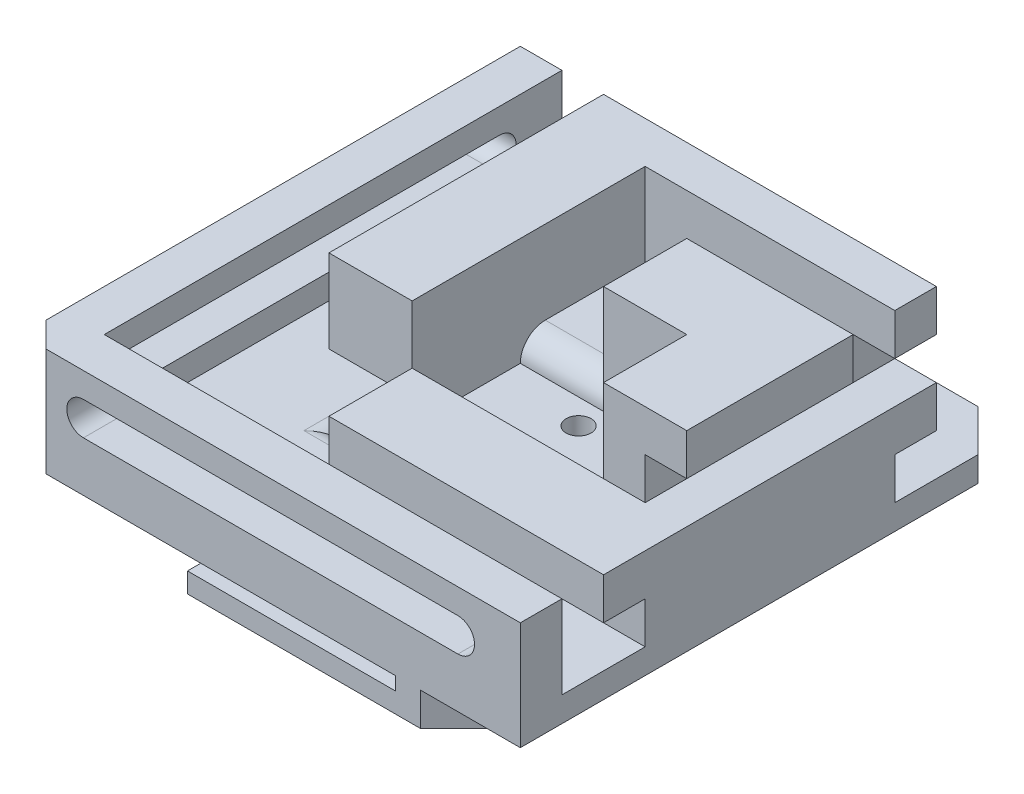
from build123d import *

# Parameters (mm, degrees)
SKETCH_2_W           = 60
SKETCH_2_H           = 60
EXTRUDE_1_DEPTH      = 3
SKETCH_6_R           = 1.5
CUT_EXTRUDE_2_DEPTH  = 3
EXTRUDE_START        = -30
EXTRUDE_2_DEPTH      = 30
EXTRUDE_START_2      = 30
EXTRUDE_3_DEPTH      = 30
CUT_EXTRUDE_START    = 13
SKETCH_9_W           = 10
SKETCH_9_H           = 10
CUT_EXTRUDE_3_DEPTH  = 10
CUT_EXTRUDE_START_2  = -15
SKETCH_10_W          = 5
SKETCH_10_H          = 5
CUT_EXTRUDE_4_DEPTH  = 5
CUT_EXTRUDE_START_3  = 10
SKETCH_11_W          = 5
SKETCH_11_H          = 5
CUT_EXTRUDE_5_DEPTH  = 5
EXTRUDE_5_DEPTH      = 1.6
EXTRUDE_START_3      = -1.6
SKETCH_17_W          = 28
SKETCH_17_H          = 8
SKETCH_17_W_2        = 8
SKETCH_17_H_2        = 28
EXTRUDE_6_DEPTH      = 2
SKETCH_21_R          = 12.5
EXTRUDE_8_DEPTH      = 4
CUT_EXTRUDE_START_4  = -4
SKETCH_22_R          = 1.5
CUT_EXTRUDE_6_DEPTH  = 4
EXTRUDE_START_4      = -4
SKETCH_23_R          = 1.5
EXTRUDE_9_DEPTH      = 4
EXTRUDE_START_5      = -3.6
SKETCH_24_W          = 8
SKETCH_24_H          = 28
SKETCH_24_W_2        = 28
SKETCH_24_H_2        = 8
EXTRUDE_10_DEPTH     = 0.4
EXTRUDE_START_6      = 3
SKETCH_25_W          = 10
SKETCH_25_H          = 3
SKETCH_25_W_2        = 3
SKETCH_25_H_2        = 10
EXTRUDE_11_DEPTH     = 10
SKETCH_26_W          = 55
SKETCH_26_H          = 5
SKETCH_26_W_2        = 5
SKETCH_26_H_2        = 55
EXTRUDE_12_DEPTH     = 10
CUT_EXTRUDE_START_5  = -30
CUT_EXTRUDE_7_DEPTH  = 5
CUT_EXTRUDE_START_6  = 25
CUT_EXTRUDE_8_DEPTH  = 5
CUT_EXTRUDE_START_7  = 3
SKETCH_31_R          = 1
CUT_EXTRUDE_10_DEPTH = 3
CUT_EXTRUDE_11_DEPTH = 4
CUT_EXTRUDE_12_DEPTH = 13
SKETCH_34_W          = 20
SKETCH_34_H          = 20
CUT_EXTRUDE_14_DEPTH = 3
SKETCH_35_W          = 20
SKETCH_35_H          = 10
EXTRUDE_14_DEPTH     = 5
SKETCH_36_W          = 20
SKETCH_36_H          = 10
EXTRUDE_15_DEPTH     = 5
EXTRUDE_16_DEPTH     = 5
EXTRUDE_18_DEPTH     = 5
EXTRUDE_19_DEPTH     = 4
CUT_EXTRUDE_START_8  = -22
CUT_EXTRUDE_15_DEPTH = 44
CUT_EXTRUDE_16_DEPTH = 44
FILLET_1_R           = 5
FILLET_2_R           = 3


# Some blends are built 0.0001 mm under size
with BuildPart() as part:
    # 草图2 → 凸台-拉伸1 (new body)
    with BuildSketch(Plane(origin=(0, 0, 0), x_dir=(1, 0, 0), z_dir=(0, 1, 0))):
        Rectangle(SKETCH_2_W, SKETCH_2_H)
    extrude(amount=EXTRUDE_1_DEPTH)

    # 草图6 → 切除-拉伸2 (cut)
    with BuildSketch(Plane(origin=(0, 0, 0), x_dir=(1, 0, 0), z_dir=(0, 1, 0))):
        with Locations(Location((0, -7, 0), (0, 0, 270))):
            Circle(SKETCH_6_R)
        with Locations(Location((7, 0, 0), (0, 0, 270))):
            Circle(SKETCH_6_R)
        with Locations(Location((0, 7, 0), (0, 0, 270))):
            Circle(SKETCH_6_R)
        with Locations(Location((-7, 0, 0), (0, 0, 270))):
            Circle(SKETCH_6_R)
    extrude(amount=CUT_EXTRUDE_2_DEPTH, mode=Mode.SUBTRACT)

    # 草图7 → 凸台-拉伸2 (add)
    with BuildSketch(Plane.XY.offset(EXTRUDE_START)):
        Polygon((-15, 3), (-15, 8), (-20, 8), (-20, 13), (-10, 13), (-10, 3), align=None)
        Polygon((10, 3), (15, 3), (15, 8), (20, 8), (20, 13), (10, 13), align=None)
    extrude(amount=EXTRUDE_2_DEPTH)

    # 草图8 → 凸台-拉伸3 (add)
    with BuildSketch(Plane(origin=(0, 0, 0), x_dir=(0, 0, -1), z_dir=(1, 0, 0)).offset(EXTRUDE_START_2)):
        Polygon((-15, 3), (-15, 8), (-20, 8), (-20, 13), (-10, 13), (-10, 3), align=None)
        Polygon((10, 3), (15, 3), (15, 8), (20, 8), (20, 13), (10, 13), align=None)
    extrude(amount=-EXTRUDE_3_DEPTH)

    # 草图9 → 切除-拉伸3 (cut)
    with BuildSketch(Plane(origin=(0, 0, 0), x_dir=(1, 0, 0), z_dir=(0, 1, 0)).offset(CUT_EXTRUDE_START)):
        with Locations((25, 15)):
            Rectangle(SKETCH_9_W, SKETCH_9_H)
        with Locations((15, 25)):
            Rectangle(SKETCH_9_W, SKETCH_9_H)
    extrude(amount=-CUT_EXTRUDE_3_DEPTH, mode=Mode.SUBTRACT)

    # 草图10 → 切除-拉伸4 (cut)
    with BuildSketch(Plane.XY.offset(CUT_EXTRUDE_START_2)):
        with Locations((17.5, 5.5)):
            Rectangle(SKETCH_10_W, SKETCH_10_H)
    extrude(amount=CUT_EXTRUDE_4_DEPTH, mode=Mode.SUBTRACT)

    # 草图11 → 切除-拉伸5 (cut)
    with BuildSketch(Plane(origin=(0, 0, 0), x_dir=(0, 0, -1), z_dir=(1, 0, 0)).offset(CUT_EXTRUDE_START_3)):
        with Locations((17.5, 5.5)):
            Rectangle(SKETCH_11_W, SKETCH_11_H)
    extrude(amount=CUT_EXTRUDE_5_DEPTH, mode=Mode.SUBTRACT)

    # 草图16 → 凸台-拉伸5 (add)
    with BuildSketch(Plane(origin=(0, 0, 0), x_dir=(1, 0, 0), z_dir=(0, 1, 0))):
        Polygon((-10, -25), (15, -25), (15, -30), (18, -30), (18, -22), (-10, -22), align=None)
        Polygon((-22, 18), (-22, -10), (-25, -10), (-25, 15), (-30, 15), (-30, 18), align=None)
    extrude(amount=-EXTRUDE_5_DEPTH)

    # 草图17 → 凸台-拉伸6 (add)
    with BuildSketch(Plane(origin=(0, 0, 0), x_dir=(1, 0, 0), z_dir=(0, 1, 0)).offset(EXTRUDE_START_3)):
        with Locations((4, -26)):
            Rectangle(SKETCH_17_W, SKETCH_17_H)
        with Locations((-26, 4)):
            Rectangle(SKETCH_17_W_2, SKETCH_17_H_2)
    extrude(amount=-EXTRUDE_6_DEPTH)

    # 草图21 → 凸台-拉伸8 (add)
    with BuildSketch(Plane(origin=(0, 0, 0), x_dir=(1, 0, 0), z_dir=(0, 1, 0))):
        with Locations(Location((0, 0, 0), (0, 0, 270))):
            Circle(SKETCH_21_R)
    extrude(amount=-EXTRUDE_8_DEPTH)

    # 草图22 → 切除-拉伸6 (cut)
    with BuildSketch(Plane(origin=(0, 0, 0), x_dir=(1, 0, 0), z_dir=(0, 1, 0)).offset(CUT_EXTRUDE_START_4)):
        with Locations(Location((7, 0, 0), (0, 0, 270))):
            Circle(SKETCH_22_R)
        with Locations(Location((0, -7, 0), (0, 0, 270))):
            Circle(SKETCH_22_R)
        with Locations(Location((-7, 0, 0), (0, 0, 270))):
            Circle(SKETCH_22_R)
        with Locations(Location((0, 7, 0), (0, 0, 270))):
            Circle(SKETCH_22_R)
    extrude(amount=CUT_EXTRUDE_6_DEPTH, mode=Mode.SUBTRACT)

    # 草图23 → 凸台-拉伸9 (add)
    with BuildSketch(Plane(origin=(0, 0, 0), x_dir=(1, 0, 0), z_dir=(0, 1, 0)).offset(EXTRUDE_START_4)):
        Polygon((22, -18), (18, -22), (-10, -22), (-22, -10), (-22, 18), (-18, 22), (-18, 30), (18, 30), (18, 22), (22, 18), (30, 18), (30, -18), align=None)
        with Locations(Location((0, 7, 0), (0, 0, 270))):
            Circle(SKETCH_23_R, mode=Mode.SUBTRACT)
        with Locations(Location((7, 0, 0), (0, 0, 270))):
            Circle(SKETCH_23_R, mode=Mode.SUBTRACT)
        with Locations(Location((-7, 0, 0), (0, 0, 270))):
            Circle(SKETCH_23_R, mode=Mode.SUBTRACT)
        with Locations(Location((0, -7, 0), (0, 0, 270))):
            Circle(SKETCH_23_R, mode=Mode.SUBTRACT)
    extrude(amount=EXTRUDE_9_DEPTH)

    # 草图24 → 凸台-拉伸10 (add)
    with BuildSketch(Plane(origin=(0, 0, 0), x_dir=(1, 0, 0), z_dir=(0, 1, 0)).offset(EXTRUDE_START_5)):
        with Locations((-26, 4)):
            Rectangle(SKETCH_24_W, SKETCH_24_H)
        with Locations((4, -26)):
            Rectangle(SKETCH_24_W_2, SKETCH_24_H_2)
    extrude(amount=-EXTRUDE_10_DEPTH)

    # 草图25 → 凸台-拉伸11 (add)
    with BuildSketch(Plane(origin=(0, 0, 0), x_dir=(1, 0, 0), z_dir=(0, 1, 0)).offset(EXTRUDE_START_6)):
        with Locations((-15, -1.5)):
            Rectangle(SKETCH_25_W, SKETCH_25_H)
        with Locations((-1.5, -15)):
            Rectangle(SKETCH_25_W_2, SKETCH_25_H_2)
    extrude(amount=EXTRUDE_11_DEPTH)

    # 草图26 → 凸台-拉伸12 (add)
    with BuildSketch(Plane(origin=(0, 0, 0), x_dir=(1, 0, 0), z_dir=(0, 1, 0)).offset(EXTRUDE_START_6)):
        with Locations((2.5, -27.5)):
            Rectangle(SKETCH_26_W, SKETCH_26_H)
        with Locations((-27.5, 2.5)):
            Rectangle(SKETCH_26_W_2, SKETCH_26_H_2)
        with Locations((-27.5, -27.5)):
            Rectangle(SKETCH_26_W_2, SKETCH_26_H)
    extrude(amount=EXTRUDE_12_DEPTH)

    # 草图27 → 切除-拉伸7 (cut)
    with BuildSketch(Plane(origin=(0, 0, 0), x_dir=(0, 0, -1), z_dir=(1, 0, 0)).offset(CUT_EXTRUDE_START_5)):
        with BuildLine():
            Line((22.5, 6), (-22.5, 6))
            ThreePointArc((-22.5, 6), (-24.5, 8), (-22.5, 10))
            Line((-22.5, 10), (22.5, 10))
            ThreePointArc((22.5, 10), (24.5, 8), (22.5, 6))
        make_face()
    extrude(amount=CUT_EXTRUDE_7_DEPTH, mode=Mode.SUBTRACT)

    # 草图28 → 切除-拉伸8 (cut)
    with BuildSketch(Plane.XY.offset(CUT_EXTRUDE_START_6)):
        with BuildLine():
            Line((-22.5, 10), (22.5, 10))
            ThreePointArc((22.5, 10), (24.5, 8), (22.5, 6))
            Line((22.5, 6), (-22.5, 6))
            ThreePointArc((-22.5, 6), (-24.5, 8), (-22.5, 10))
        make_face()
    extrude(amount=CUT_EXTRUDE_8_DEPTH, mode=Mode.SUBTRACT)

    # 草图31 → 切除-拉伸10 (cut)
    with BuildSketch(Plane(origin=(0, 0, 0), x_dir=(1, 0, 0), z_dir=(0, 1, 0)).offset(CUT_EXTRUDE_START_7)):
        with Locations(Location((-20, -20, 0), (0, 0, 270))):
            Circle(SKETCH_31_R)
    extrude(amount=-CUT_EXTRUDE_10_DEPTH, mode=Mode.SUBTRACT)

    # 草图32 → 切除-拉伸11 (cut)
    with BuildSketch(Plane(origin=(0, 0, 0), x_dir=(1, 0, 0), z_dir=(0, 1, 0))):
        Polygon((30, 30), (30, 25), (25, 30), align=None)
    extrude(amount=CUT_EXTRUDE_11_DEPTH, mode=Mode.SUBTRACT)

    # 草图33 → 切除-拉伸12 (cut)
    with BuildSketch(Plane(origin=(0, 0, 0), x_dir=(1, 0, 0), z_dir=(0, 1, 0))):
        Polygon((-30, -30), (-27, -30), (-30, -27), align=None)
    extrude(amount=CUT_EXTRUDE_12_DEPTH, mode=Mode.SUBTRACT)

    # 草图34 → 切除-拉伸14 (cut)
    with BuildSketch(Plane(origin=(0, 0, 0), x_dir=(1, 0, 0), z_dir=(0, 1, 0)).offset(CUT_EXTRUDE_START_7)):
        Rectangle(SKETCH_34_W, SKETCH_34_H)
    extrude(amount=-CUT_EXTRUDE_14_DEPTH, mode=Mode.SUBTRACT)

    # 草图35 → 凸台-拉伸14 (add)
    with BuildSketch(Plane(origin=(0, 0, 0), x_dir=(0, 0, -1), z_dir=(1, 0, 0)).offset(EXTRUDE_START_2)):
        with Locations((0, 8)):
            Rectangle(SKETCH_35_W, SKETCH_35_H)
    extrude(amount=-EXTRUDE_14_DEPTH)

    # 草图36 → 凸台-拉伸15 (add)
    with BuildSketch(Plane.XY.offset(EXTRUDE_START)):
        with Locations((0, 8)):
            Rectangle(SKETCH_36_W, SKETCH_36_H)
    extrude(amount=EXTRUDE_15_DEPTH)

    # 草图37 → 凸台-拉伸16 (add)
    with BuildSketch(Plane.XY.offset(EXTRUDE_START)):
        Polygon((10, 3), (10, 13), (20, 13), (20, 8), (15, 8), (15, 3), align=None)
    extrude(amount=EXTRUDE_16_DEPTH)

    # 草图38 → 凸台-拉伸18 (add)
    with BuildSketch(Plane(origin=(0, 0, 0), x_dir=(0, 0, -1), z_dir=(1, 0, 0)).offset(EXTRUDE_START_2)):
        Polygon((10, 13), (20, 13), (20, 8), (15, 8), (15, 3), (10, 3), align=None)
    extrude(amount=-EXTRUDE_18_DEPTH)

    # 草图40 → 凸台-拉伸19 (add)
    with BuildSketch(Plane(origin=(0, 0, 0), x_dir=(1, 0, 0), z_dir=(0, 1, 0))):
        Polygon((-30, 18), (-18, 30), (-18, 22), (-22, 18), align=None)
        Polygon((18, 30), (30, 18), (22, 18), (18, 22), align=None)
        Polygon((30, -18), (18, -30), (18, -22), (22, -18), align=None)
    extrude(amount=-EXTRUDE_19_DEPTH)

    # 草图41 → 切除-拉伸15 (cut)
    with BuildSketch(Plane.XY.offset(CUT_EXTRUDE_START_8)):
        Polygon((30, 0), (26, -4), (30, -4), align=None)
    extrude(amount=CUT_EXTRUDE_15_DEPTH, mode=Mode.SUBTRACT)

    # 草图42 → 切除-拉伸16 (cut)
    with BuildSketch(Plane(origin=(0, 0, 0), x_dir=(0, 0, -1), z_dir=(1, 0, 0)).offset(CUT_EXTRUDE_START_8)):
        Polygon((30, -4), (30, 0), (26, -4), align=None)
    extrude(amount=CUT_EXTRUDE_16_DEPTH, mode=Mode.SUBTRACT)

    # 圆角1
    # the kernel refuses this fillet: 5 mm, written as the material it adds along each edge
    with BuildSketch(Plane(origin=(9.339745962, 0, -38.660254038), x_dir=(1.104671909501692e-12, -1.0, -1.104671909501665e-12), z_dir=(0.7071067811865389, 0, 0.7071067811865562))) as fillet_1_piece_1_section:
        with BuildLine():
            CenterArc((5, 4.898979486), FILLET_1_R, 180, 78.463040967)
            Line((0, 4.898979486), (-0.1, 4.898979486))
            Line((-0.1, 4.898979486), (-0.1, 0))
            Line((-0.1, 0), (0, -0.1))
            ThreePointArc((0, -0.1), (2, -0.1), (3.98, -0.09797959))
            Line((3.98, -0.09797959), (4, 0))
        make_face()
    fillet_1_piece_1 = extrude(amount=41.465460176, mode=Mode.PRIVATE)
    fillet_1_piece_1 = split(fillet_1_piece_1, bisect_by=Plane(origin=(24.77055683, -0.893670134, -30), z_dir=(0, 0, 1)), keep=Keep.TOP, mode=Mode.PRIVATE)
    fillet_1_piece_1 = split(fillet_1_piece_1, bisect_by=Plane(origin=(24.77055683, -3.061556652, -26.938443348), z_dir=(0, 0.7071067811865475, 0.7071067811865477)), keep=Keep.TOP, mode=Mode.PRIVATE)
    fillet_1_piece_1 = split(fillet_1_piece_1, bisect_by=Plane(origin=(26.938443348, -3.061556652, -24.77055683), z_dir=(-0.7071067811865591, 0.7071067811865359, 0)), keep=Keep.TOP, mode=Mode.PRIVATE)
    fillet_1_piece_1 = split(fillet_1_piece_1, bisect_by=Plane(origin=(30, -0.893670134, -24.77055683), z_dir=(-1, 0, 0)), keep=Keep.TOP, mode=Mode.PRIVATE)
    add(fillet_1_piece_1)

    # 圆角2
    fillet_2_edges = [part.edges().sort_by_distance(p)[0] for p in [
        (-6.5, 3, 10),
        (-10, 3, 6.5),
        (-5, 3, -10),
        (10, 3, 5),
    ]]
    fillet(fillet_2_edges, radius=FILLET_2_R - 0.0001)  # a hair under: the kernel refuses the full size


solid = part.part
